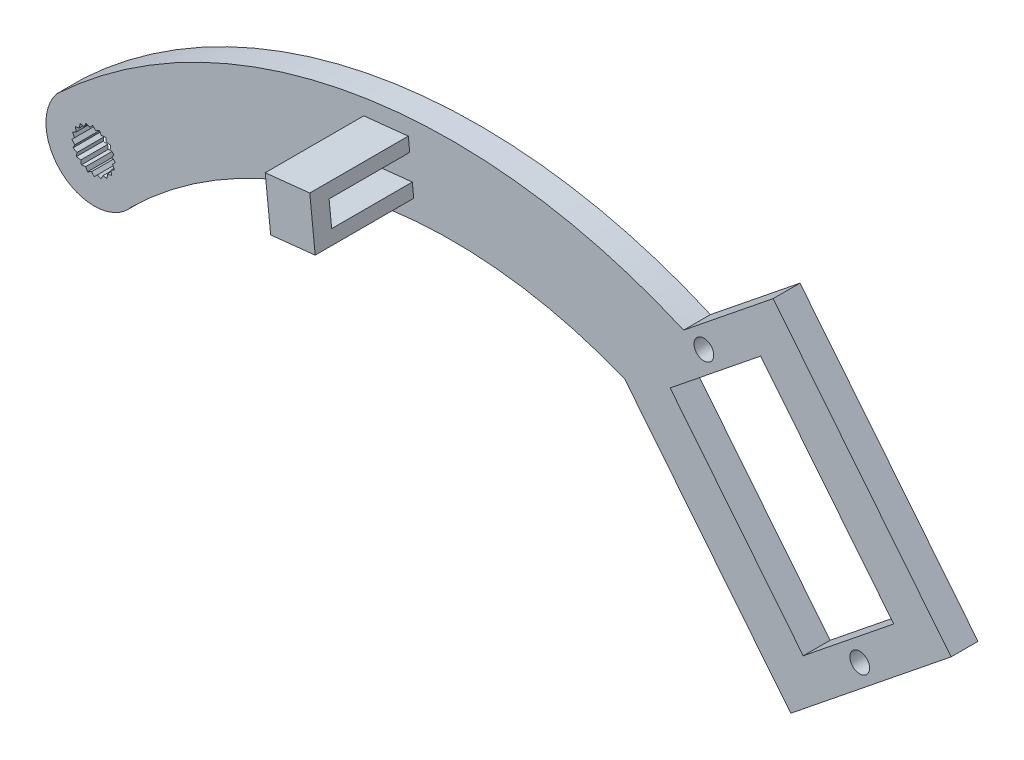
from build123d import *

# Parameters (mm, degrees)
BOSS_EXTRUDE1_OUTLINE_R = 1.1
BOSS_EXTRUDE1_DEPTH     = 3
BOSS_EXTRUDE2_DEPTH     = 11
BOSS_EXTRUDE3_REACH     = 87.92
SKETCH5_W               = 5
SKETCH5_H               = 2


# Read off the part's stored shape, not the designer's step: Boss-Extrude1
with BuildPart() as part:
    # Boss-Extrude1 outline → Boss-Extrude1 (new body)
    with BuildSketch(Plane.XY):
        with BuildLine():
            Line((-16.861546239, -6.996941033), (-16.235942246, -6.960409413))
            ThreePointArc((-16.235942246, -6.960409413), (-14.264395542, -6.327834493), (-12.678246106, -4.996941033))
            ThreePointArc((-12.678246106, -4.996941033), (13.21501224, 8.679812005), (42.365911354, 5.89781951))
            Line((42.365911354, 5.89781951), (60.907203246, -17.149637471))
            Line((60.907203246, -17.149637471), (78.805808552, -2.750510239))
            Line((78.805808552, -2.750510239), (58.935546262, 21.948902186))
            Line((58.935546262, 21.948902186), (48.942403416, 13.909586673))
            ThreePointArc((48.942403416, 13.909586673), (12.120494673, 18.357071745), (-21.044846371, 1.753058967))
            ThreePointArc((-21.044846371, 1.753058967), (-21.710837424, -3.940345657), (-16.861546239, -6.996941033))
        make_face()
        Polygon((-15.008213446, -0.217369118), (-15.079375496, -0.657391661), (-14.639590345, -0.883380518), (-14.841297197, -1.275911723), (-14.495267888, -1.621941033), (-14.810453449, -1.937126594), (-14.586057014, -2.377726392), (-14.983250587, -2.580016139), (-14.906078059, -3.068407726), (-15.346355155, -3.137977509), (-15.423969348, -3.626299102), (-15.864183346, -3.556331166), (-16.088978162, -3.996727842), (-16.485988624, -3.794078961), (-16.835934444, -4.143392379), (-17.150834826, -3.827921897), (-17.591637385, -4.051919766), (-17.793567832, -3.654543407), (-18.282029013, -3.731274208), (-18.351200586, -3.290934374), (-18.839451787, -3.212878581), (-18.769085755, -2.772728041), (-19.209278949, -2.547535028), (-19.006271099, -2.150708001), (-19.355267888, -1.800446409), (-19.039512742, -1.485831463), (-19.263111863, -1.044826504), (-18.865553043, -0.843255522), (-18.941842054, -0.354725146), (-18.501439842, -0.285951839), (-18.422942512, 0.202228569), (-17.982855791, 0.131464499), (-17.757264764, 0.571453851), (-17.360621498, 0.368087198), (-17.01004442, 0.716767072), (-16.695715168, 0.400727521), (-16.254508168, 0.623927711), (-16.053296817, 0.226186755), (-15.564697645, 0.302033914), (-15.496322662, -0.138430316), align=None, mode=Mode.SUBTRACT)
        with Locations((68.60124446, -8.393050085)):
            Circle(BOSS_EXTRUDE1_OUTLINE_R, mode=Mode.SUBTRACT)
        Polygon((72.402709352, -2.767977433), (62.295668796, -10.898921739), (47.439985558, 7.567198225), (57.547026113, 15.698142531), align=None, mode=Mode.SUBTRACT)
        with Locations((51.208221203, 13.165538506)):
            Circle(BOSS_EXTRUDE1_OUTLINE_R, mode=Mode.SUBTRACT)
    extrude(amount=BOSS_EXTRUDE1_DEPTH)

    # Sketch4 → Boss-Extrude2 (add)
    with BuildSketch(Plane.XY.offset(3)):
        Polygon((13.242665436, 16.771623459), (18.214871239, 17.298092309), (18.372811894, 15.806430568), (13.40060609, 15.279961718), align=None)
        Polygon((13.847221233, 11.061929815), (18.819427036, 11.588398665), (18.661486381, 13.080060406), (13.689280578, 12.553591556), align=None)
    extrude(amount=BOSS_EXTRUDE2_DEPTH)

    # Sketch5 → Boss-Extrude3 (add, up to next)
    with BuildSketch(Plane(origin=(-1.16269721, 10.981029202, 0), x_dir=(0.994441160657232, 0.10529376995196534, 0), z_dir=(-0.10529376995196534, 0.994441160657232, 0)), mode=Mode.PRIVATE) as boss_extrude3_sk1:
        with Locations((17.434999048, -13)):
            Rectangle(SKETCH5_W, SKETCH5_H)
    boss_extrude3_tool1 = extrude(boss_extrude3_sk1.sketch, amount=BOSS_EXTRUDE3_REACH, mode=Mode.PRIVATE) - part.part
    add(boss_extrude3_tool1.solids().sort_by_distance((16.175383, 12.816826, 13))[0])


solid = part.part
